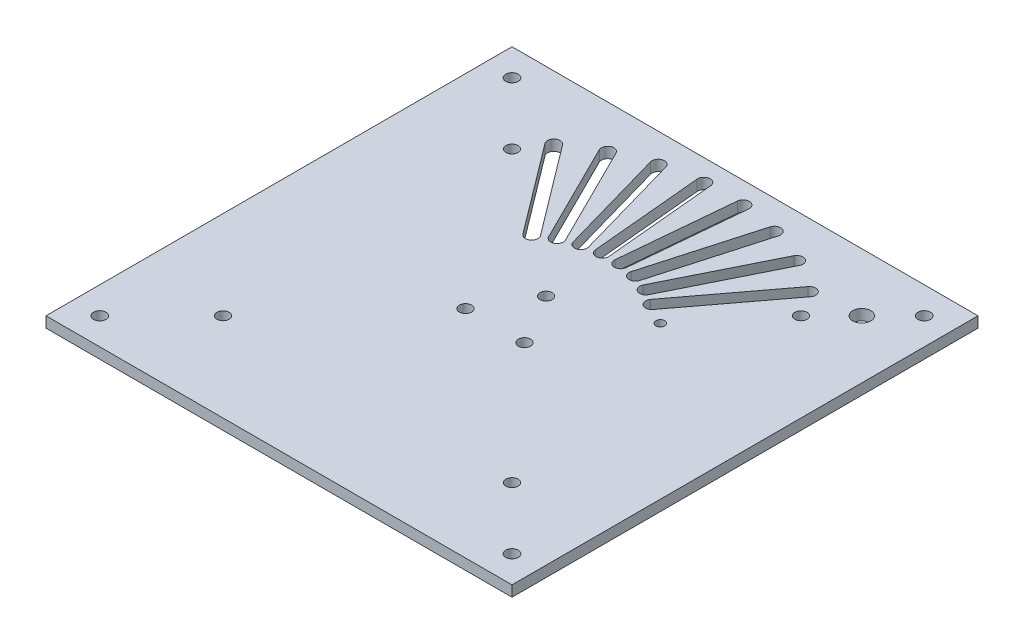
from build123d import *

# Parameters (mm, degrees)
SKETCH2_W                 = 130
SKETCH2_H                 = 130
BOSS_EXTRUDE1_DEPTH       = 3
CORNERPIECE_HOLES_REACH   = 93.973
SKETCH4_R                 = 1.75
CUT_EXTRUDE2_REACH        = 93.973
SKETCH6_R                 = 1.7
CUT_EXTRUDE3_REACH        = 93.973
SKETCH8_R                 = 1.7
PRIMARY_WIRE_HOLE_REACH   = 93.973
SKETCH9_R                 = 2.5
SECONDARY_WIRE_HOLE_REACH = 93.973
SKETCH10_R                = 1.25
CUT_EXTRUDE6_REACH        = 93.973


with BuildPart() as part:
    # Sketch2 → Boss-Extrude1 (new body)
    with BuildSketch(Plane(origin=(0, 0, 0), x_dir=(1, 0, 0), z_dir=(0, 1, 0))):
        Rectangle(SKETCH2_W, SKETCH2_H)
    extrude(amount=BOSS_EXTRUDE1_DEPTH)

    # Sketch4 → Cornerpiece holes (cut, up to next)
    with BuildSketch(Plane(origin=(0, 3, 0), x_dir=(1, 0, 0), z_dir=(0, 1, 0)), mode=Mode.PRIVATE) as cornerpiece_holes_sk1:
        with Locations((-57.5, 57.5)):
            Circle(SKETCH4_R)
    cornerpiece_holes_tool1 = extrude(cornerpiece_holes_sk1.sketch, amount=-CORNERPIECE_HOLES_REACH, mode=Mode.PRIVATE) & part.part
    # Sketch4 → Cornerpiece holes (cut, up to next)
    with BuildSketch(Plane(origin=(0, 3, 0), x_dir=(1, 0, 0), z_dir=(0, 1, 0)), mode=Mode.PRIVATE) as cornerpiece_holes_sk2:
        with Locations((57.5, 57.5)):
            Circle(SKETCH4_R)
    cornerpiece_holes_tool2 = extrude(cornerpiece_holes_sk2.sketch, amount=-CORNERPIECE_HOLES_REACH, mode=Mode.PRIVATE) & part.part
    # Sketch4 → Cornerpiece holes (cut, up to next)
    with BuildSketch(Plane(origin=(0, 3, 0), x_dir=(1, 0, 0), z_dir=(0, 1, 0)), mode=Mode.PRIVATE) as cornerpiece_holes_sk3:
        with Locations((57.5, -57.5)):
            Circle(SKETCH4_R)
    cornerpiece_holes_tool3 = extrude(cornerpiece_holes_sk3.sketch, amount=-CORNERPIECE_HOLES_REACH, mode=Mode.PRIVATE) & part.part
    # Sketch4 → Cornerpiece holes (cut, up to next)
    with BuildSketch(Plane(origin=(0, 3, 0), x_dir=(1, 0, 0), z_dir=(0, 1, 0)), mode=Mode.PRIVATE) as cornerpiece_holes_sk4:
        with Locations((-57.5, -57.5)):
            Circle(SKETCH4_R)
    cornerpiece_holes_tool4 = extrude(cornerpiece_holes_sk4.sketch, amount=-CORNERPIECE_HOLES_REACH, mode=Mode.PRIVATE) & part.part
    add(cornerpiece_holes_tool1.solids().sort_by_distance((-57.5, 3, -57.5))[0], mode=Mode.SUBTRACT)
    add(cornerpiece_holes_tool2.solids().sort_by_distance((57.5, 3, -57.5))[0], mode=Mode.SUBTRACT)
    add(cornerpiece_holes_tool3.solids().sort_by_distance((57.5, 3, 57.5))[0], mode=Mode.SUBTRACT)
    add(cornerpiece_holes_tool4.solids().sort_by_distance((-57.5, 3, 57.5))[0], mode=Mode.SUBTRACT)

    # Sketch6 → Cut-Extrude2 (cut, up to next)
    with BuildSketch(Plane(origin=(0, 3, 0), x_dir=(1, 0, 0), z_dir=(0, 1, 0)), mode=Mode.PRIVATE) as cut_extrude2_sk1:
        with Locations((-40.305086528, 40.305086528)):
            Circle(SKETCH6_R)
    cut_extrude2_tool1 = extrude(cut_extrude2_sk1.sketch, amount=-CUT_EXTRUDE2_REACH, mode=Mode.PRIVATE) & part.part
    # Sketch6 → Cut-Extrude2 (cut, up to next)
    with BuildSketch(Plane(origin=(0, 3, 0), x_dir=(1, 0, 0), z_dir=(0, 1, 0)), mode=Mode.PRIVATE) as cut_extrude2_sk2:
        with Locations((40.305086528, 40.305086528)):
            Circle(SKETCH6_R)
    cut_extrude2_tool2 = extrude(cut_extrude2_sk2.sketch, amount=-CUT_EXTRUDE2_REACH, mode=Mode.PRIVATE) & part.part
    # Sketch6 → Cut-Extrude2 (cut, up to next)
    with BuildSketch(Plane(origin=(0, 3, 0), x_dir=(1, 0, 0), z_dir=(0, 1, 0)), mode=Mode.PRIVATE) as cut_extrude2_sk3:
        with Locations((40.305086528, -40.305086528)):
            Circle(SKETCH6_R)
    cut_extrude2_tool3 = extrude(cut_extrude2_sk3.sketch, amount=-CUT_EXTRUDE2_REACH, mode=Mode.PRIVATE) & part.part
    # Sketch6 → Cut-Extrude2 (cut, up to next)
    with BuildSketch(Plane(origin=(0, 3, 0), x_dir=(1, 0, 0), z_dir=(0, 1, 0)), mode=Mode.PRIVATE) as cut_extrude2_sk4:
        with Locations((-40.305086528, -40.305086528)):
            Circle(SKETCH6_R)
    cut_extrude2_tool4 = extrude(cut_extrude2_sk4.sketch, amount=-CUT_EXTRUDE2_REACH, mode=Mode.PRIVATE) & part.part
    add(cut_extrude2_tool1.solids().sort_by_distance((-40.305087, 3, -40.305087))[0], mode=Mode.SUBTRACT)
    add(cut_extrude2_tool2.solids().sort_by_distance((40.305087, 3, -40.305087))[0], mode=Mode.SUBTRACT)
    add(cut_extrude2_tool3.solids().sort_by_distance((40.305087, 3, 40.305087))[0], mode=Mode.SUBTRACT)
    add(cut_extrude2_tool4.solids().sort_by_distance((-40.305087, 3, 40.305087))[0], mode=Mode.SUBTRACT)

    # Sketch8 → Cut-Extrude3 (cut, up to next)
    with BuildSketch(Plane(origin=(0, 3, 0), x_dir=(1, 0, 0), z_dir=(0, 1, 0)), mode=Mode.PRIVATE) as cut_extrude3_sk1:
        with Locations((0, 9.5)):
            Circle(SKETCH8_R)
    cut_extrude3_tool1 = extrude(cut_extrude3_sk1.sketch, amount=-CUT_EXTRUDE3_REACH, mode=Mode.PRIVATE) & part.part
    # Sketch8 → Cut-Extrude3 (cut, up to next)
    with BuildSketch(Plane(origin=(0, 3, 0), x_dir=(1, 0, 0), z_dir=(0, 1, 0)), mode=Mode.PRIVATE) as cut_extrude3_sk2:
        with Locations((8.227241336, -4.75)):
            Circle(SKETCH8_R)
    cut_extrude3_tool2 = extrude(cut_extrude3_sk2.sketch, amount=-CUT_EXTRUDE3_REACH, mode=Mode.PRIVATE) & part.part
    # Sketch8 → Cut-Extrude3 (cut, up to next)
    with BuildSketch(Plane(origin=(0, 3, 0), x_dir=(1, 0, 0), z_dir=(0, 1, 0)), mode=Mode.PRIVATE) as cut_extrude3_sk3:
        with Locations((-8.227241336, -4.75)):
            Circle(SKETCH8_R)
    cut_extrude3_tool3 = extrude(cut_extrude3_sk3.sketch, amount=-CUT_EXTRUDE3_REACH, mode=Mode.PRIVATE) & part.part
    add(cut_extrude3_tool1.solids().sort_by_distance((0, 3, -9.5))[0], mode=Mode.SUBTRACT)
    add(cut_extrude3_tool2.solids().sort_by_distance((8.227241, 3, 4.75))[0], mode=Mode.SUBTRACT)
    add(cut_extrude3_tool3.solids().sort_by_distance((-8.227241, 3, 4.75))[0], mode=Mode.SUBTRACT)

    # Sketch9 → Primary wire hole (cut, up to next)
    with BuildSketch(Plane(origin=(0, 3, 0), x_dir=(1, 0, 0), z_dir=(0, 1, 0)), mode=Mode.PRIVATE) as primary_wire_hole_sk1:
        with Locations((48.790367902, 48.790367902)):
            Circle(SKETCH9_R)
    primary_wire_hole_tool1 = extrude(primary_wire_hole_sk1.sketch, amount=-PRIMARY_WIRE_HOLE_REACH, mode=Mode.PRIVATE) & part.part
    add(primary_wire_hole_tool1.solids().sort_by_distance((48.790368, 3, -48.790368))[0], mode=Mode.SUBTRACT)

    # Sketch10 → Secondary wire hole (cut, up to next)
    with BuildSketch(Plane(origin=(0, 3, 0), x_dir=(1, 0, 0), z_dir=(0, 1, 0)), mode=Mode.PRIVATE) as secondary_wire_hole_sk1:
        with Locations((22.506385739, 18.885099973)):
            Circle(SKETCH10_R)
    secondary_wire_hole_tool1 = extrude(secondary_wire_hole_sk1.sketch, amount=-SECONDARY_WIRE_HOLE_REACH, mode=Mode.PRIVATE) & part.part
    add(secondary_wire_hole_tool1.solids().sort_by_distance((22.506386, 3, -18.8851))[0], mode=Mode.SUBTRACT)

    # Sketch11 → Cut-Extrude6 (cut, up to next)
    with BuildSketch(Plane(origin=(0, 3, 0), x_dir=(1, 0, 0), z_dir=(0, 1, 0)), mode=Mode.PRIVATE) as cut_extrude6_sk1:
        with BuildLine():
            Line((-34.259927979, 48.372330261), (-15.380990703, 23.319134311))
            ThreePointArc((-15.380990703, 23.319134311), (-15.725426555, 20.868345878), (-18.176214988, 21.21278173))
            Line((-18.176214988, 21.21278173), (-37.055152264, 46.26597768))
            ThreePointArc((-37.055152264, 46.26597768), (-36.710716412, 48.716766113), (-34.259927979, 48.372330261))
        make_face()
    cut_extrude6_tool1 = extrude(cut_extrude6_sk1.sketch, amount=-CUT_EXTRUDE6_REACH, mode=Mode.PRIVATE) & part.part
    # Sketch11 → Cut-Extrude6 (cut, up to next)
    with BuildSketch(Plane(origin=(0, 3, 0), x_dir=(1, 0, 0), z_dir=(0, 1, 0)), mode=Mode.PRIVATE) as cut_extrude6_sk2:
        with BuildLine():
            Line((-27.938203096, 52.278884913), (-13.975987518, 24.187365977))
            ThreePointArc((-13.975987518, 24.187365977), (-11.629987027, 23.399151731), (-10.841772782, 25.745152222))
            Line((-10.841772782, 25.745152222), (-24.80398836, 53.836671159))
            ThreePointArc((-24.80398836, 53.836671159), (-27.149988851, 54.624885404), (-27.938203096, 52.278884913))
        make_face()
    cut_extrude6_tool2 = extrude(cut_extrude6_sk2.sketch, amount=-CUT_EXTRUDE6_REACH, mode=Mode.PRIVATE) & part.part
    # Sketch11 → Cut-Extrude6 (cut, up to next)
    with BuildSketch(Plane(origin=(0, 3, 0), x_dir=(1, 0, 0), z_dir=(0, 1, 0)), mode=Mode.PRIVATE) as cut_extrude6_sk3:
        with BuildLine():
            Line((-17.87286129, 56.517128637), (-9.301329978, 26.340883824))
            ThreePointArc((-9.301329978, 26.340883824), (-7.139754963, 25.135647974), (-5.934519112, 27.297222989))
            Line((-5.934519112, 27.297222989), (-14.506050425, 57.473467801))
            ThreePointArc((-14.506050425, 57.473467801), (-16.667625439, 58.678703651), (-17.87286129, 56.517128637))
        make_face()
    cut_extrude6_tool3 = extrude(cut_extrude6_sk3.sketch, amount=-CUT_EXTRUDE6_REACH, mode=Mode.PRIVATE) & part.part
    # Sketch11 → Cut-Extrude6 (cut, up to next)
    with BuildSketch(Plane(origin=(0, 3, 0), x_dir=(1, 0, 0), z_dir=(0, 1, 0)), mode=Mode.PRIVATE) as cut_extrude6_sk4:
        with BuildLine():
            Line((-7.200805802, 58.836837065), (-4.310928692, 27.600231771))
            ThreePointArc((-4.310928692, 27.600231771), (-2.407156164, 26.018887355), (-0.825811748, 27.922659883))
            Line((-0.825811748, 27.922659883), (-3.715688858, 59.159265177))
            ThreePointArc((-3.715688858, 59.159265177), (-5.619461386, 60.740609593), (-7.200805802, 58.836837065))
        make_face()
    cut_extrude6_tool4 = extrude(cut_extrude6_sk4.sketch, amount=-CUT_EXTRUDE6_REACH, mode=Mode.PRIVATE) & part.part
    # Sketch11 → Cut-Extrude6 (cut, up to next)
    with BuildSketch(Plane(origin=(0, 3, 0), x_dir=(1, 0, 0), z_dir=(0, 1, 0)), mode=Mode.PRIVATE) as cut_extrude6_sk5:
        with BuildLine():
            Line((3.715688858, 59.159265177), (0.825811748, 27.922659883))
            ThreePointArc((0.825811748, 27.922659883), (2.407156164, 26.018887355), (4.310928692, 27.600231771))
            Line((4.310928692, 27.600231771), (7.200805802, 58.836837065))
            ThreePointArc((7.200805802, 58.836837065), (5.619461386, 60.740609593), (3.715688858, 59.159265177))
        make_face()
    cut_extrude6_tool5 = extrude(cut_extrude6_sk5.sketch, amount=-CUT_EXTRUDE6_REACH, mode=Mode.PRIVATE) & part.part
    # Sketch11 → Cut-Extrude6 (cut, up to next)
    with BuildSketch(Plane(origin=(0, 3, 0), x_dir=(1, 0, 0), z_dir=(0, 1, 0)), mode=Mode.PRIVATE) as cut_extrude6_sk6:
        with BuildLine():
            Line((14.506050425, 57.473467801), (5.934519112, 27.297222989))
            ThreePointArc((5.934519112, 27.297222989), (7.139754963, 25.135647974), (9.301329978, 26.340883824))
            Line((9.301329978, 26.340883824), (17.87286129, 56.517128637))
            ThreePointArc((17.87286129, 56.517128637), (16.667625439, 58.678703651), (14.506050425, 57.473467801))
        make_face()
    cut_extrude6_tool6 = extrude(cut_extrude6_sk6.sketch, amount=-CUT_EXTRUDE6_REACH, mode=Mode.PRIVATE) & part.part
    # Sketch11 → Cut-Extrude6 (cut, up to next)
    with BuildSketch(Plane(origin=(0, 3, 0), x_dir=(1, 0, 0), z_dir=(0, 1, 0)), mode=Mode.PRIVATE) as cut_extrude6_sk7:
        with BuildLine():
            Line((24.80398836, 53.836671159), (10.841772782, 25.745152222))
            ThreePointArc((10.841772782, 25.745152222), (11.629987027, 23.399151731), (13.975987518, 24.187365977))
            Line((13.975987518, 24.187365977), (27.938203096, 52.278884913))
            ThreePointArc((27.938203096, 52.278884913), (27.149988851, 54.624885404), (24.80398836, 53.836671159))
        make_face()
    cut_extrude6_tool7 = extrude(cut_extrude6_sk7.sketch, amount=-CUT_EXTRUDE6_REACH, mode=Mode.PRIVATE) & part.part
    # Sketch11 → Cut-Extrude6 (cut, up to next)
    with BuildSketch(Plane(origin=(0, 3, 0), x_dir=(1, 0, 0), z_dir=(0, 1, 0)), mode=Mode.PRIVATE) as cut_extrude6_sk8:
        with BuildLine():
            Line((34.259927979, 48.372330261), (15.380990703, 23.319134311))
            ThreePointArc((15.380990703, 23.319134311), (15.725426555, 20.868345878), (18.176214988, 21.21278173))
            Line((18.176214988, 21.21278173), (37.055152264, 46.26597768))
            ThreePointArc((37.055152264, 46.26597768), (36.710716412, 48.716766113), (34.259927979, 48.372330261))
        make_face()
    cut_extrude6_tool8 = extrude(cut_extrude6_sk8.sketch, amount=-CUT_EXTRUDE6_REACH, mode=Mode.PRIVATE) & part.part
    add(cut_extrude6_tool1.solids().sort_by_distance((-26.218071, 3, -34.792556))[0], mode=Mode.SUBTRACT)
    add(cut_extrude6_tool2.solids().sort_by_distance((-19.389988, 3, -39.012019))[0], mode=Mode.SUBTRACT)
    add(cut_extrude6_tool3.solids().sort_by_distance((-11.90369, 3, -41.907176))[0], mode=Mode.SUBTRACT)
    add(cut_extrude6_tool4.solids().sort_by_distance((-4.013309, 3, -43.379748))[0], mode=Mode.SUBTRACT)
    add(cut_extrude6_tool5.solids().sort_by_distance((4.013309, 3, -43.379748))[0], mode=Mode.SUBTRACT)
    add(cut_extrude6_tool6.solids().sort_by_distance((11.90369, 3, -41.907176))[0], mode=Mode.SUBTRACT)
    add(cut_extrude6_tool7.solids().sort_by_distance((19.389988, 3, -39.012019))[0], mode=Mode.SUBTRACT)
    add(cut_extrude6_tool8.solids().sort_by_distance((26.218071, 3, -34.792556))[0], mode=Mode.SUBTRACT)


solid = part.part
